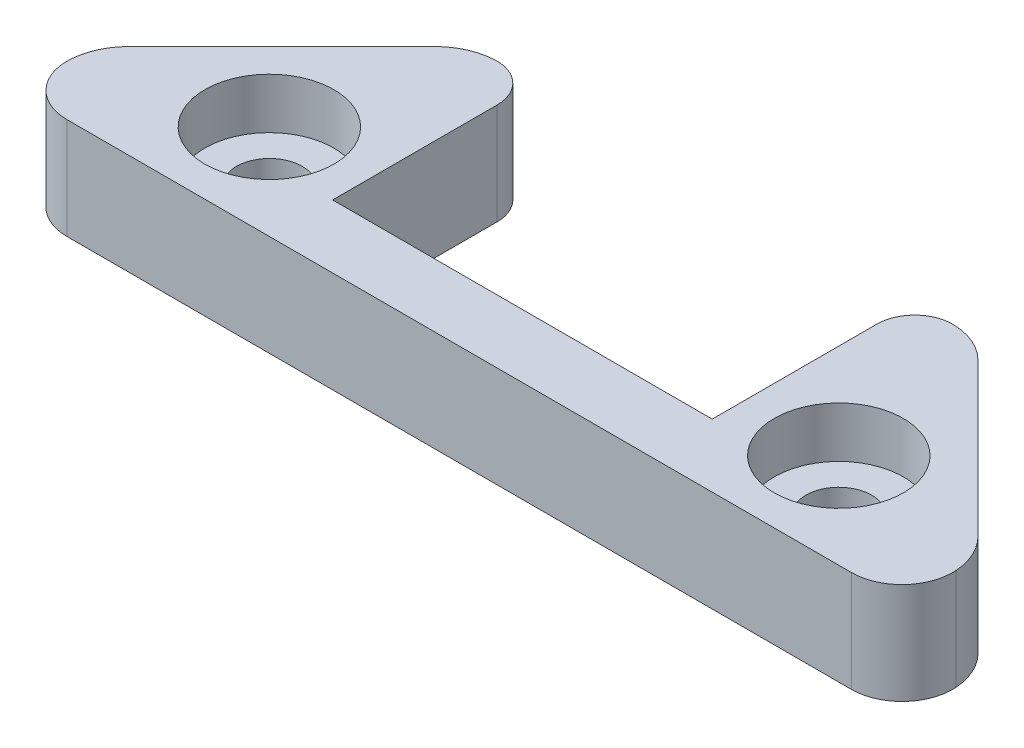
from build123d import *

# Parameters (mm, degrees)
ESQUISSE1_R             = 2.6
BOSS_EXTRU_1_DEPTH      = 8
ESQUISSE3_R             = 5.1
ENL_V_MAT_EXTRU_2_DEPTH = 4
ESQUISSE4_R             = 5.5
ESQUISSE4_R_2           = 4.5
ENL_V_MAT_EXTRU_3_DEPTH = 2
CONG_1_R                = 5
CONG_2_R                = 3
CONG_3_R                = 4


with BuildPart() as part:
    # Esquisse1 → Boss.-Extru.1 (new body)
    with BuildSketch(Plane(origin=(0, 0, 0), x_dir=(1, 0, 0), z_dir=(0, 1, 0))):
        Polygon((-35, 0), (35, 0), (35, 6), (20, 21), (15, 21), (15, 5), (-15, 5), (-15, 21), (-20, 21), (-35, 6), align=None)
        with Locations((22.5, 7.5)):
            Circle(ESQUISSE1_R, mode=Mode.SUBTRACT)
        with Locations((-22.5, 7.5)):
            Circle(ESQUISSE1_R, mode=Mode.SUBTRACT)
    extrude(amount=BOSS_EXTRU_1_DEPTH)

    # Esquisse3 → Enlèv. mat.-Extru.2 (cut)
    with BuildSketch(Plane(origin=(0, 8, 0), x_dir=(1, 0, 0), z_dir=(0, 1, 0))):
        with Locations((-22.5, 7.5)):
            Circle(ESQUISSE3_R)
        with Locations((22.5, 7.5)):
            Circle(ESQUISSE3_R)
    extrude(amount=-ENL_V_MAT_EXTRU_2_DEPTH, mode=Mode.SUBTRACT)

    # Esquisse4 → Enlèv. mat.-Extru.3 (cut)
    # profile 1 of 2: a face of its own
    with BuildSketch(Plane.XZ):
        with Locations((-22.5, -7.5)):
            Circle(ESQUISSE4_R)
        with Locations((-22.5, -7.5)):
            Circle(ESQUISSE4_R_2, mode=Mode.SUBTRACT)
    # profile 2 of 2: a face of its own
    with BuildSketch(Plane.XZ):
        with Locations((22.5, -7.5)):
            Circle(ESQUISSE4_R)
        with Locations((22.5, -7.5)):
            Circle(ESQUISSE4_R_2, mode=Mode.SUBTRACT)
    extrude(amount=-ENL_V_MAT_EXTRU_3_DEPTH, mode=Mode.SUBTRACT)

    # Congé1
    cong_1_edges = [part.edges().sort_by_distance(p)[0] for p in [
        (-35, 4, -6),
        (-20, 4, -21),
        (35, 4, -6),
        (20, 4, -21),
    ]]
    fillet(cong_1_edges, radius=CONG_1_R)

    # Congé2
    cong_2_edges = [part.edges().sort_by_distance(p)[0] for p in [
        (-15, 4, -21),
        (15, 4, -21),
    ]]
    fillet(cong_2_edges, radius=CONG_2_R)

    # Congé3
    cong_3_edges = [part.edges().sort_by_distance(p)[0] for p in [
        (-35, 4, 0),
        (35, 4, 0),
    ]]
    fillet(cong_3_edges, radius=CONG_3_R)


solid = part.part
